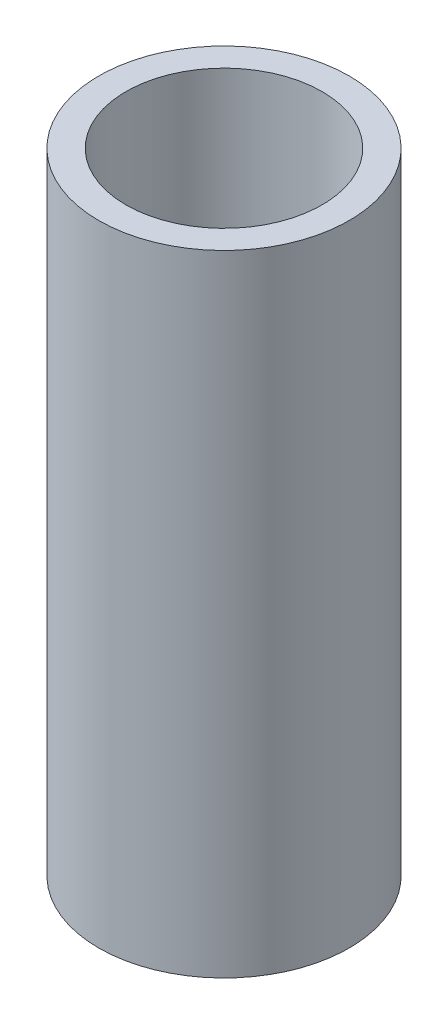
from build123d import *

# Parameters (mm, degrees)
SKETCH1_R           = 22.5
BOSS_EXTRUDE1_DEPTH = 113.20074178
SKETCH2_R           = 17.631508169
CUT_EXTRUDE1_DEPTH  = 118.587873267


with BuildPart() as part:
    # Sketch1 → Boss-Extrude1 (new body)
    with BuildSketch(Plane(origin=(0, 0, 0), x_dir=(1, 0, 0), z_dir=(0, 1, 0))):
        Circle(SKETCH1_R)
    extrude(amount=BOSS_EXTRUDE1_DEPTH)

    # Sketch2 → Cut-Extrude1 (cut, through all)
    with BuildSketch(Plane(origin=(0, 0, 0), x_dir=(1, 0, 0), z_dir=(0, 1, 0))):
        Circle(SKETCH2_R)
    extrude(amount=CUT_EXTRUDE1_DEPTH, mode=Mode.SUBTRACT)


solid = part.part
